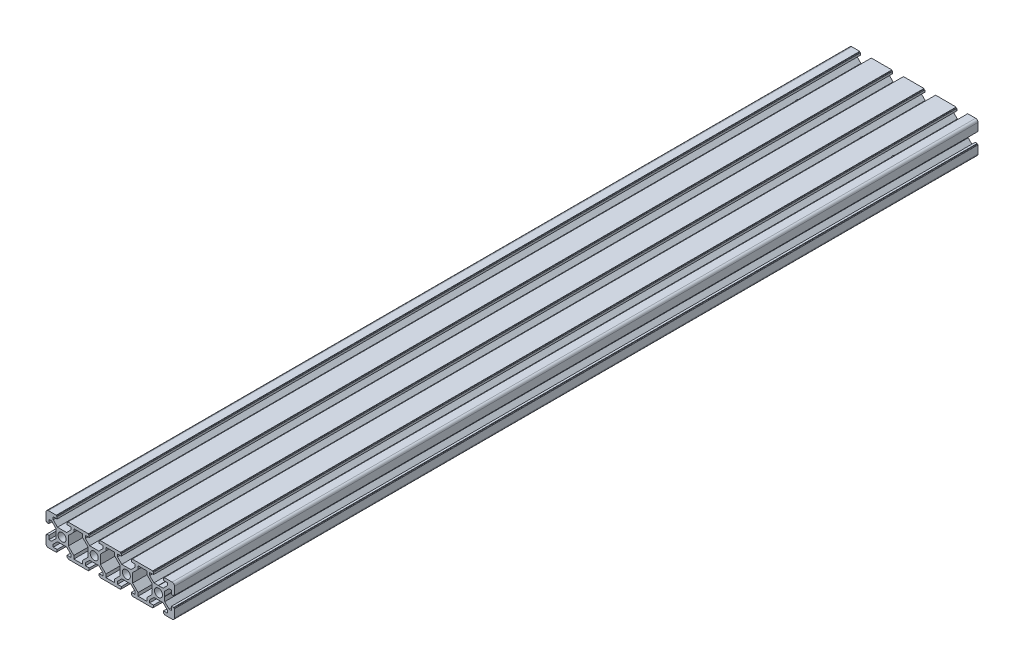
from build123d import *

# Parameters (mm, degrees)
SKETCH_1_R                    = 2.5
EXTRUDE_1_DEPTH               = 500
HOLE_START                    = -3.9
HOLE_WIZARD_6_0_6_1_OUTLINE_R = 3
HOLE_WIZARD_6_0_6_1_DEPTH     = 7.960660272


# Read off the part's stored shape, not the designer's step: Ø6.0 (6) 直径孔1
with BuildPart() as part:
    # 草图1 → 凸台-拉伸1 (new body)
    with BuildSketch(Plane.XY):
        with BuildLine():
            Line((-7.160660172, 3.9), (-12.839339828, 3.9))
            Line((-12.839339828, 3.9), (-15.5, 6.560660172))
            Line((-15.5, 6.560660172), (-15.5, 8.2))
            Line((-15.5, 8.2), (-13.1, 8.2))
            Line((-13.1, 8.2), (-13.1, 9.5))
            Line((-13.1, 9.5), (-13.4, 9.5))
            ThreePointArc((-13.4, 9.5), (-13.541421356, 9.558578644), (-13.6, 9.7))
            Line((-13.6, 9.7), (-13.6, 10))
            Line((-13.6, 10), (-26.4, 10))
            Line((-26.4, 10), (-26.4, 9.7))
            ThreePointArc((-26.4, 9.7), (-26.458578644, 9.558578644), (-26.6, 9.5))
            Line((-26.6, 9.5), (-26.9, 9.5))
            Line((-26.9, 9.5), (-26.9, 8.2))
            Line((-26.9, 8.2), (-24.5, 8.2))
            Line((-24.5, 8.2), (-24.5, 6.560660172))
            Line((-24.5, 6.560660172), (-27.160660172, 3.9))
            Line((-27.160660172, 3.9), (-32.839339828, 3.9))
            Line((-32.839339828, 3.9), (-35.5, 6.560660172))
            Line((-35.5, 6.560660172), (-35.5, 8.2))
            Line((-35.5, 8.2), (-33.1, 8.2))
            Line((-33.1, 8.2), (-33.1, 9.5))
            Line((-33.1, 9.5), (-33.4, 9.5))
            ThreePointArc((-33.4, 9.5), (-33.541421356, 9.558578644), (-33.6, 9.7))
            Line((-33.6, 9.7), (-33.6, 10))
            Line((-33.6, 10), (-38.5, 10))
            ThreePointArc((-38.5, 10), (-39.560660172, 9.560660172), (-40, 8.5))
            Line((-40, 8.5), (-40, 3.6))
            Line((-40, 3.6), (-39.7, 3.6))
            ThreePointArc((-39.7, 3.6), (-39.558578644, 3.541421356), (-39.5, 3.4))
            Line((-39.5, 3.4), (-39.5, 3.1))
            Line((-39.5, 3.1), (-38.2, 3.1))
            Line((-38.2, 3.1), (-38.2, 5.5))
            Line((-38.2, 5.5), (-36.560660172, 5.5))
            Line((-36.560660172, 5.5), (-33.9, 2.839339828))
            Line((-33.9, 2.839339828), (-33.9, -2.839339828))
            Line((-33.9, -2.839339828), (-36.560660172, -5.5))
            Line((-36.560660172, -5.5), (-38.2, -5.5))
            Line((-38.2, -5.5), (-38.2, -3.1))
            Line((-38.2, -3.1), (-39.5, -3.1))
            Line((-39.5, -3.1), (-39.5, -3.4))
            ThreePointArc((-39.5, -3.4), (-39.558578644, -3.541421356), (-39.7, -3.6))
            Line((-39.7, -3.6), (-40, -3.6))
            Line((-40, -3.6), (-40, -8.5))
            ThreePointArc((-40, -8.5), (-39.560660172, -9.560660172), (-38.5, -10))
            Line((-38.5, -10), (-33.6, -10))
            Line((-33.6, -10), (-33.6, -9.7))
            ThreePointArc((-33.6, -9.7), (-33.541421356, -9.558578644), (-33.4, -9.5))
            Line((-33.4, -9.5), (-33.1, -9.5))
            Line((-33.1, -9.5), (-33.1, -8.2))
            Line((-33.1, -8.2), (-35.5, -8.2))
            Line((-35.5, -8.2), (-35.5, -6.560660172))
            Line((-35.5, -6.560660172), (-32.839339828, -3.9))
            Line((-32.839339828, -3.9), (-27.160660172, -3.9))
            Line((-27.160660172, -3.9), (-24.5, -6.560660172))
            Line((-24.5, -6.560660172), (-24.5, -8.2))
            Line((-24.5, -8.2), (-26.9, -8.2))
            Line((-26.9, -8.2), (-26.9, -9.5))
            Line((-26.9, -9.5), (-26.6, -9.5))
            ThreePointArc((-26.6, -9.5), (-26.458578644, -9.558578644), (-26.4, -9.7))
            Line((-26.4, -9.7), (-26.4, -10))
            Line((-26.4, -10), (-13.6, -10))
            Line((-13.6, -10), (-13.6, -9.7))
            ThreePointArc((-13.6, -9.7), (-13.541421356, -9.558578644), (-13.4, -9.5))
            Line((-13.4, -9.5), (-13.1, -9.5))
            Line((-13.1, -9.5), (-13.1, -8.2))
            Line((-13.1, -8.2), (-15.5, -8.2))
            Line((-15.5, -8.2), (-15.5, -6.560660172))
            Line((-15.5, -6.560660172), (-12.839339828, -3.9))
            Line((-12.839339828, -3.9), (-7.160660172, -3.9))
            Line((-7.160660172, -3.9), (-4.5, -6.560660172))
            Line((-4.5, -6.560660172), (-4.5, -8.2))
            Line((-4.5, -8.2), (-6.9, -8.2))
            Line((-6.9, -8.2), (-6.9, -9.5))
            Line((-6.9, -9.5), (-6.6, -9.5))
            ThreePointArc((-6.6, -9.5), (-6.458578644, -9.558578644), (-6.4, -9.7))
            Line((-6.4, -9.7), (-6.4, -10))
            Line((-6.4, -10), (6.4, -10))
            Line((6.4, -10), (6.4, -9.7))
            ThreePointArc((6.4, -9.7), (6.458578644, -9.558578644), (6.6, -9.5))
            Line((6.6, -9.5), (6.9, -9.5))
            Line((6.9, -9.5), (6.9, -8.2))
            Line((6.9, -8.2), (4.5, -8.2))
            Line((4.5, -8.2), (4.5, -6.560660172))
            Line((4.5, -6.560660172), (7.160660172, -3.9))
            Line((7.160660172, -3.9), (12.839339828, -3.9))
            Line((12.839339828, -3.9), (15.5, -6.560660172))
            Line((15.5, -6.560660172), (15.5, -8.2))
            Line((15.5, -8.2), (13.1, -8.2))
            Line((13.1, -8.2), (13.1, -9.5))
            Line((13.1, -9.5), (13.4, -9.5))
            ThreePointArc((13.4, -9.5), (13.541421356, -9.558578644), (13.6, -9.7))
            Line((13.6, -9.7), (13.6, -10))
            Line((13.6, -10), (26.4, -10))
            Line((26.4, -10), (26.4, -9.7))
            ThreePointArc((26.4, -9.7), (26.458578644, -9.558578644), (26.6, -9.5))
            Line((26.6, -9.5), (26.9, -9.5))
            Line((26.9, -9.5), (26.9, -8.2))
            Line((26.9, -8.2), (24.5, -8.2))
            Line((24.5, -8.2), (24.5, -6.560660172))
            Line((24.5, -6.560660172), (27.160660172, -3.9))
            Line((27.160660172, -3.9), (29.9, -3.9))
            Line((29.9, -3.9), (30, -3.8))
            Line((30, -3.8), (30.1, -3.9))
            Line((30.1, -3.9), (32.839339828, -3.9))
            Line((32.839339828, -3.9), (35.5, -6.560660172))
            Line((35.5, -6.560660172), (35.5, -8.2))
            Line((35.5, -8.2), (33.1, -8.2))
            Line((33.1, -8.2), (33.1, -9.5))
            Line((33.1, -9.5), (33.4, -9.5))
            ThreePointArc((33.4, -9.5), (33.541421356, -9.558578644), (33.6, -9.7))
            Line((33.6, -9.7), (33.6, -10))
            Line((33.6, -10), (38.5, -10))
            ThreePointArc((38.5, -10), (39.560660172, -9.560660172), (40, -8.5))
            Line((40, -8.5), (40, -3.6))
            Line((40, -3.6), (39.7, -3.6))
            ThreePointArc((39.7, -3.6), (39.558578644, -3.541421356), (39.5, -3.4))
            Line((39.5, -3.4), (39.5, -3.1))
            Line((39.5, -3.1), (38.2, -3.1))
            Line((38.2, -3.1), (38.2, -5.5))
            Line((38.2, -5.5), (36.560660172, -5.5))
            Line((36.560660172, -5.5), (33.9, -2.839339828))
            Line((33.9, -2.839339828), (33.9, -0.1))
            Line((33.9, -0.1), (33.8, 0))
            Line((33.8, 0), (33.9, 0.1))
            Line((33.9, 0.1), (33.9, 2.839339828))
            Line((33.9, 2.839339828), (36.560660172, 5.5))
            Line((36.560660172, 5.5), (38.2, 5.5))
            Line((38.2, 5.5), (38.2, 3.1))
            Line((38.2, 3.1), (39.5, 3.1))
            Line((39.5, 3.1), (39.5, 3.4))
            ThreePointArc((39.5, 3.4), (39.558578644, 3.541421356), (39.7, 3.6))
            Line((39.7, 3.6), (40, 3.6))
            Line((40, 3.6), (40, 8.5))
            ThreePointArc((40, 8.5), (39.560660172, 9.560660172), (38.5, 10))
            Line((38.5, 10), (33.6, 10))
            Line((33.6, 10), (33.6, 9.7))
            ThreePointArc((33.6, 9.7), (33.541421356, 9.558578644), (33.4, 9.5))
            Line((33.4, 9.5), (33.1, 9.5))
            Line((33.1, 9.5), (33.1, 8.2))
            Line((33.1, 8.2), (35.5, 8.2))
            Line((35.5, 8.2), (35.5, 6.560660172))
            Line((35.5, 6.560660172), (32.839339828, 3.9))
            Line((32.839339828, 3.9), (30.1, 3.9))
            Line((30.1, 3.9), (30, 3.8))
            Line((30, 3.8), (29.9, 3.9))
            Line((29.9, 3.9), (27.160660172, 3.9))
            Line((27.160660172, 3.9), (24.5, 6.560660172))
            Line((24.5, 6.560660172), (24.5, 8.2))
            Line((24.5, 8.2), (26.9, 8.2))
            Line((26.9, 8.2), (26.9, 9.5))
            Line((26.9, 9.5), (26.6, 9.5))
            ThreePointArc((26.6, 9.5), (26.458578644, 9.558578644), (26.4, 9.7))
            Line((26.4, 9.7), (26.4, 10))
            Line((26.4, 10), (13.6, 10))
            Line((13.6, 10), (13.6, 9.7))
            ThreePointArc((13.6, 9.7), (13.541421356, 9.558578644), (13.4, 9.5))
            Line((13.4, 9.5), (13.1, 9.5))
            Line((13.1, 9.5), (13.1, 8.2))
            Line((13.1, 8.2), (15.5, 8.2))
            Line((15.5, 8.2), (15.5, 6.560660172))
            Line((15.5, 6.560660172), (12.839339828, 3.9))
            Line((12.839339828, 3.9), (7.160660172, 3.9))
            Line((7.160660172, 3.9), (4.5, 6.560660172))
            Line((4.5, 6.560660172), (4.5, 8.2))
            Line((4.5, 8.2), (6.9, 8.2))
            Line((6.9, 8.2), (6.9, 9.5))
            Line((6.9, 9.5), (6.6, 9.5))
            ThreePointArc((6.6, 9.5), (6.458578644, 9.558578644), (6.4, 9.7))
            Line((6.4, 9.7), (6.4, 10))
            Line((6.4, 10), (-6.4, 10))
            Line((-6.4, 10), (-6.4, 9.7))
            ThreePointArc((-6.4, 9.7), (-6.458578644, 9.558578644), (-6.6, 9.5))
            Line((-6.6, 9.5), (-6.9, 9.5))
            Line((-6.9, 9.5), (-6.9, 8.2))
            Line((-6.9, 8.2), (-4.5, 8.2))
            Line((-4.5, 8.2), (-4.5, 6.560660172))
            Line((-4.5, 6.560660172), (-7.160660172, 3.9))
        make_face()
        with Locations((30, 0)):
            Circle(SKETCH_1_R, mode=Mode.SUBTRACT)
        with Locations((10, 0)):
            Circle(SKETCH_1_R, mode=Mode.SUBTRACT)
        with Locations((-10, 0)):
            Circle(SKETCH_1_R, mode=Mode.SUBTRACT)
        with Locations((-30, 0)):
            Circle(SKETCH_1_R, mode=Mode.SUBTRACT)
        Polygon((26.1, 0.1), (26.2, 0), (26.1, -0.1), (26.1, -2.839339828), (22.7, -6.239339828), (22.7, -8.2), (17.3, -8.2), (17.3, -6.239339828), (13.9, -2.839339828), (13.9, 2.839339828), (17.3, 6.239339828), (17.3, 8.2), (22.7, 8.2), (22.7, 6.239339828), (26.1, 2.839339828), align=None, mode=Mode.SUBTRACT)
        Polygon((-2.7, -6.239339828), (-6.1, -2.839339828), (-6.1, 2.839339828), (-2.7, 6.239339828), (-2.7, 8.2), (2.7, 8.2), (2.7, 6.239339828), (6.1, 2.839339828), (6.1, -2.839339828), (2.7, -6.239339828), (2.7, -8.2), (-2.7, -8.2), align=None, mode=Mode.SUBTRACT)
        Polygon((-22.7, -6.239339828), (-26.1, -2.839339828), (-26.1, 2.839339828), (-22.7, 6.239339828), (-22.7, 8.2), (-17.3, 8.2), (-17.3, 6.239339828), (-13.9, 2.839339828), (-13.9, -2.839339828), (-17.3, -6.239339828), (-17.3, -8.2), (-22.7, -8.2), align=None, mode=Mode.SUBTRACT)
    extrude(amount=EXTRUDE_1_DEPTH)

    # Ø6.0 (6) 直径孔1 outline → Ø6.0 (6) 直径孔1 (cut)
    with BuildSketch(Plane(origin=(0, 0, 0), x_dir=(1, 0, 0), z_dir=(0, 1, 0)).offset(HOLE_START)):
        with Locations((-30, -40)):
            Circle(HOLE_WIZARD_6_0_6_1_OUTLINE_R)
        with Locations((-10, -40)):
            Circle(HOLE_WIZARD_6_0_6_1_OUTLINE_R)
        with Locations((10, -40)):
            Circle(HOLE_WIZARD_6_0_6_1_OUTLINE_R)
        with Locations((30, -40)):
            Circle(HOLE_WIZARD_6_0_6_1_OUTLINE_R)
    extrude(amount=HOLE_WIZARD_6_0_6_1_DEPTH, mode=Mode.SUBTRACT)


solid = part.part
